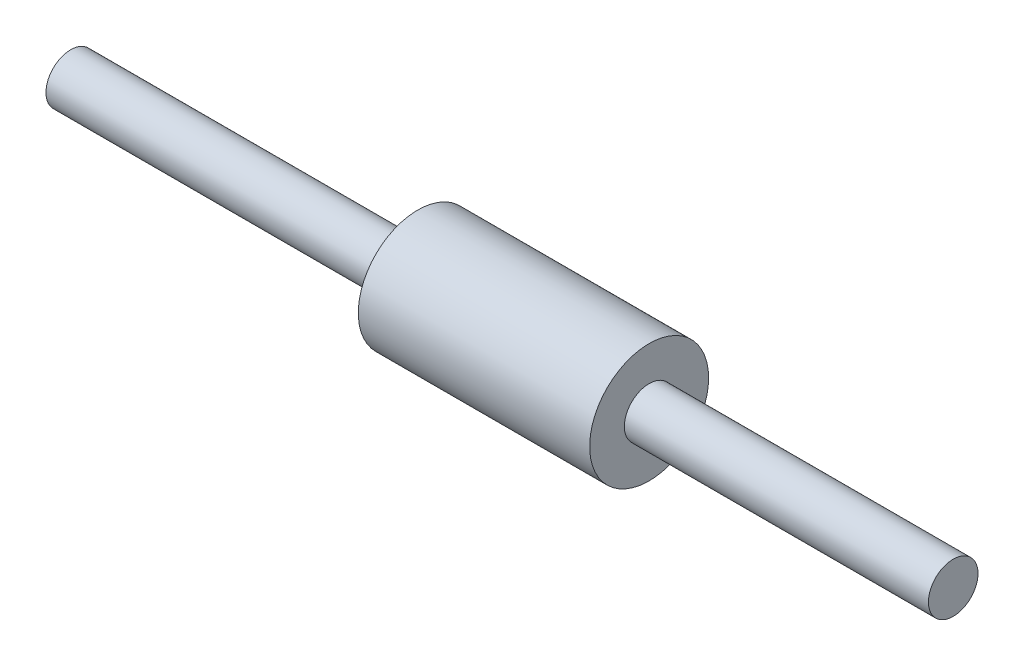
from build123d import *


with BuildPart() as part:
    # Sketch1 → Revolve1 (revolve)
    with BuildSketch(Plane.XY):
        Polygon((127, 0), (127, 7.5), (35, 7.5), (35, 18), (-35, 18), (-35, 7.5), (-140, 7.5), (-140, 5.5), (-127, 5.5), (-127, 0), align=None)
    revolve(axis=Axis((196.356223274, 0, 0), (-1, 0, 0)))


solid = part.part
